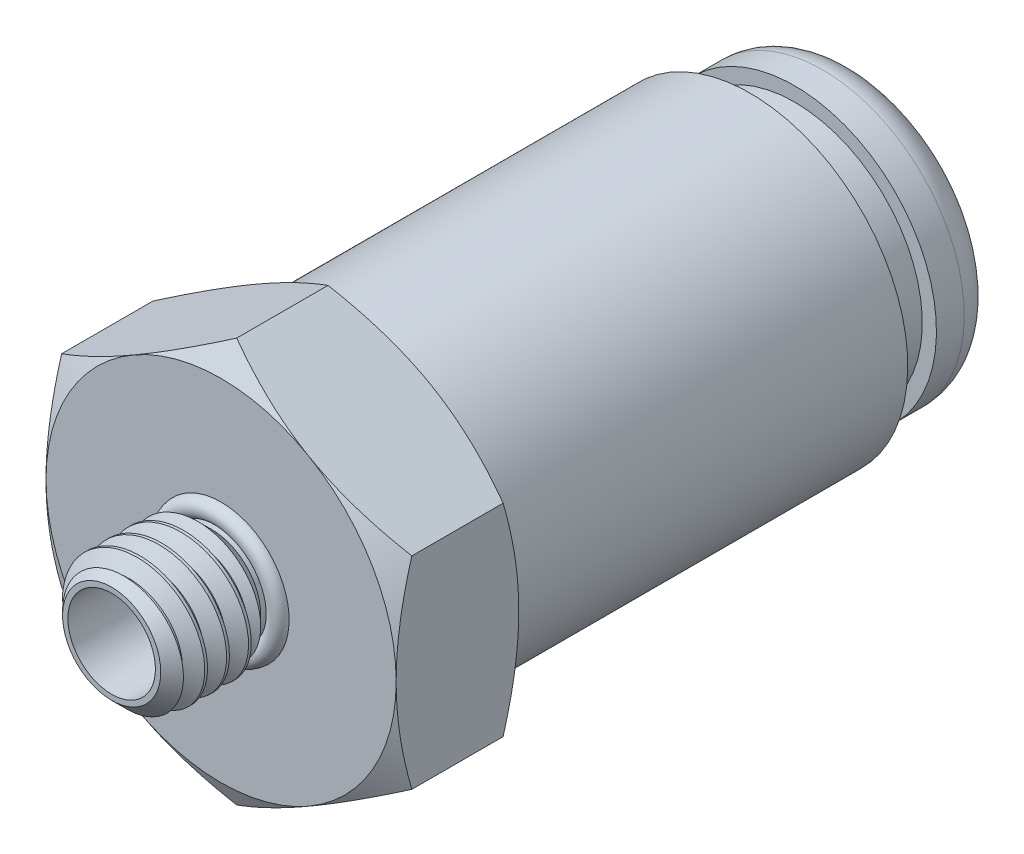
from build123d import *

# Parameters (mm, degrees)
SKETCH1_R          = 1.5
EXTRUDE1_DEPTH     = 2.5
CUT_SWEEP1_PITCH   = 0.5
EXTRUDE2_DEPTH     = 2.8
SKETCH6_OUTSIDE_W  = 44.148
SKETCH6_OUTSIDE_H  = 45.386
SKETCH6_OUTSIDE_R  = 4
CUT_EXTRUDE1_DEPTH = 9.088469224
CUT_EXTRUDE1_DRAFT = -60
SKETCH7_OUTSIDE_W  = 39.41
SKETCH7_OUTSIDE_H  = 40.648
SKETCH7_OUTSIDE_R  = 4
CUT_EXTRUDE2_DEPTH = 7.721111019
CUT_EXTRUDE2_DRAFT = -60
SKETCH9_R          = 1
CUT_EXTRUDE3_DEPTH = 14.199368672
CUT_EXTRUDE4_START = -1.8
SKETCH10_R         = 2
CUT_EXTRUDE4_DEPTH = 1.8
SKETCH12_W         = 0.433012702
SKETCH12_H         = 0.433012702
SKETCH13_R         = 0.216506351


with BuildPart() as part:
    # Sketch1 → Extrude1 (new body)
    with BuildSketch(Plane.XY):
        Circle(SKETCH1_R)
    extrude(amount=-EXTRUDE1_DEPTH)

    # Cut-Sweep1: the profile of Sketch3 screwed along a right-hand helix of 6 turns, 6 arcs to a turn; built about Z, then put on its axis
    cut_sweep1_z = Axis((0, 0, 0), (0, 0, 1))
    cut_sweep1_corners = [(1.175240474, 0, -0.25), (1.175240474, 0, -0.1875), (1.527063294, 0, 0.015625), (1.527063294, 0, -0.453125)]
    with BuildLine(mode=Mode.PRIVATE) as cut_sweep1_profile:
        Line(cut_sweep1_corners[0], cut_sweep1_corners[1])
        Line(cut_sweep1_corners[1], cut_sweep1_corners[2])
        Line(cut_sweep1_corners[2], cut_sweep1_corners[3])
        Line(cut_sweep1_corners[3], cut_sweep1_corners[0])
    cut_sweep1_cap = Face(cut_sweep1_profile.wire())
    cut_sweep1_turn_angles = [0, 30, 60, 90, 120, 150, 180, 210, 240, 270, 300, 330, 360]
    cut_sweep1_turn_weights = [1, 0.8660254037844387, 1, 0.8660254037844387, 1, 0.8660254037844387, 1, 0.8660254037844387, 1, 0.8660254037844387, 1, 0.8660254037844387, 1]
    cut_sweep1_turn_rails = [Edge.make_bspline([Vector(p[0], p[1], 0).rotate(cut_sweep1_z, cut_sweep1_turn_angles[k]) / cut_sweep1_turn_weights[k] + Vector(0, 0, p[2] + CUT_SWEEP1_PITCH * cut_sweep1_turn_angles[k] / 360) for k in range(13)], [0, 0, 0, 1, 1, 2, 2, 3, 3, 4, 4, 5, 5, 6, 6, 6], 2, cut_sweep1_turn_weights) for p in cut_sweep1_corners]
    cut_sweep1_turn_sides = [Face.make_surface_from_curves(cut_sweep1_turn_rails[p[0]], cut_sweep1_turn_rails[p[1]]) for p in [(0, 1), (1, 2), (2, 3), (3, 0)]]
    cut_sweep1 = Plane(origin=(0, 0, 0), x_dir=(0, 1, 0), z_dir=(0, 0, -1)) * Solid(Shell([*[p.moved(Location((0, 0, CUT_SWEEP1_PITCH * i))) for i in range(6) for p in cut_sweep1_turn_sides], cut_sweep1_cap, cut_sweep1_cap.rotate(cut_sweep1_z, 2160).moved(Location((0, 0, CUT_SWEEP1_PITCH * 2160 / 360)))]))
    add(cut_sweep1, mode=Mode.SUBTRACT)

    # Sketch4 → Cut-Revolve1 (revolve, cut)
    with BuildSketch(Plane(origin=(0, 0, 0), x_dir=(0, 0, -1), z_dir=(1, 0, 0)), mode=Mode.PRIVATE) as cut_revolve1_sk:
        Polygon((2.5, 1.121113886), (2.283493649, 1.121113886), (1.850480947, 1.554126588), (2.5, 1.554126588), align=None)
        Polygon((0.433012702, 1.554126588), (0, 1.121113886), (0, 1.554126588), align=None)
    revolve(cut_revolve1_sk.sketch.rotate(Axis((0, 0, 0), (0, 0, -1)), 90), axis=Axis((0, 0, 0), (0, 0, -1)), mode=Mode.SUBTRACT)

    # Sketch5 → Extrude2 (add)
    with BuildSketch(Plane(origin=(0, 0, -2.5), x_dir=(-1, 0, 0), z_dir=(0, 0, -1))):
        Polygon((0, 4.618802154), (-4, 2.309401077), (-4, -2.309401077), (0, -4.618802154), (4, -2.309401077), (4, 2.309401077), align=None)
    extrude(amount=EXTRUDE2_DEPTH)


with BuildPart() as cut_extrude1_tool:
    # Sketch6 outside → Cut-Extrude1 (with draft: the straight prism first)
    with BuildSketch(Plane(origin=(0, 0, -5.3), x_dir=(-1, 0, 0), z_dir=(0, 0, -1))):
        Rectangle(SKETCH6_OUTSIDE_W, SKETCH6_OUTSIDE_H)
        Circle(SKETCH6_OUTSIDE_R, mode=Mode.SUBTRACT)
    extrude(amount=-CUT_EXTRUDE1_DEPTH)
    # Cut-Extrude1: the draft: its side faces are tilted about the plane it starts from
    cut_extrude1_sides = [cut_extrude1_tool.faces().sort_by_distance(p)[0] for p in [
        (0, -22.693, -0.755765388),
        (-22.074, 0, -0.755765388),
        (0, 22.693, -0.755765388),
        (22.074, 0, -0.755765388),
        (4, 0, -0.755765388),
    ]]
    draft(cut_extrude1_sides, Plane(origin=(0, 0, -5.3), x_dir=(-1, 0, 0), z_dir=(0, 0, -1)), CUT_EXTRUDE1_DRAFT)


with BuildPart() as part_1:
    add(part.part)

    # Cut-Extrude1: cut by cut_extrude1_tool
    add(cut_extrude1_tool.part, mode=Mode.SUBTRACT)


with BuildPart() as cut_extrude2_tool:
    # Sketch7 outside → Cut-Extrude2 (with draft: the straight prism first)
    with BuildSketch(Plane.XY.offset(-2.5)):
        Rectangle(SKETCH7_OUTSIDE_W, SKETCH7_OUTSIDE_H)
        Circle(SKETCH7_OUTSIDE_R, mode=Mode.SUBTRACT)
    extrude(amount=-CUT_EXTRUDE2_DEPTH)
    # Cut-Extrude2: the draft: its side faces are tilted about the plane it starts from
    cut_extrude2_sides = [cut_extrude2_tool.faces().sort_by_distance(p)[0] for p in [
        (0, -20.324, -6.36055551),
        (19.705, 0, -6.36055551),
        (0, 20.324, -6.36055551),
        (-19.705, 0, -6.36055551),
        (-4, 0, -6.36055551),
    ]]
    draft(cut_extrude2_sides, Plane.XY.offset(-2.5), CUT_EXTRUDE2_DRAFT)


with BuildPart() as part_2:
    add(part_1.part)

    # Cut-Extrude2: cut by cut_extrude2_tool
    add(cut_extrude2_tool.part, mode=Mode.SUBTRACT)

    # Sketch8 → Revolve1 (revolve)
    with BuildSketch(Plane(origin=(0, 0, 0), x_dir=(0, 0, -1), z_dir=(1, 0, 0)), mode=Mode.PRIVATE) as revolve1_sk:
        with BuildLine():
            Line((15.603, 3.24), (16.238, 3.24))
            ThreePointArc((16.238, 3.24), (16.776815367, 3.016815367), (17, 2.478))
            Line((17, 2.478), (17, 2.381))
            Line((17, 2.381), (16.619, 2))
            Line((16.619, 2), (5.3, 2))
            Line((5.3, 2), (5.3, 3.6))
            Line((5.3, 3.6), (14.587, 3.6))
            Line((14.587, 3.6), (14.587, 2.916))
            Line((14.587, 2.916), (15.603, 2.916))
            Line((15.603, 2.916), (15.603, 3.24))
        make_face()
    revolve(revolve1_sk.sketch.rotate(Axis((0, 0, 0), (0, 0, -1)), 180), axis=Axis((0, 0, 0), (0, 0, -1)))

    # Sketch9 → Cut-Extrude3 (cut, through all)
    with BuildSketch(Plane(origin=(0, 0, -5.3), x_dir=(-1, 0, 0), z_dir=(0, 0, -1))):
        Circle(SKETCH9_R)
    extrude(amount=-CUT_EXTRUDE3_DEPTH, mode=Mode.SUBTRACT)

    # Sketch10 → Cut-Extrude4 (cut)
    with BuildSketch(Plane(origin=(0, 0, -5.3), x_dir=(-1, 0, 0), z_dir=(0, 0, -1)).offset(CUT_EXTRUDE4_START)):
        with Locations(Location((0, 0, 0), (0, 0, 270))):
            Circle(SKETCH10_R)
    extrude(amount=CUT_EXTRUDE4_DEPTH, mode=Mode.SUBTRACT)

    # Sketch12 → Cut-Revolve2 (revolve, cut)
    with BuildSketch(Plane(origin=(0, 0, 0), x_dir=(0, 0, -1), z_dir=(1, 0, 0)), mode=Mode.PRIVATE) as cut_revolve2_sk:
        with Locations((2.5, 1.337620237)):
            Rectangle(SKETCH12_W, SKETCH12_H)
    revolve(cut_revolve2_sk.sketch.rotate(Axis((0, 0, -17), (0, 0, 1)), 270), axis=Axis((0, 0, -17), (0, 0, 1)), mode=Mode.SUBTRACT)


with BuildPart() as body_2:
    # Sketch13 → Revolve2 (revolve)
    with BuildSketch(Plane(origin=(0, 0, 0), x_dir=(0, 0, -1), z_dir=(1, 0, 0)), mode=Mode.PRIVATE) as revolve2_sk:
        with Locations((2.5, 1.337620237)):
            Circle(SKETCH13_R)
    revolve(revolve2_sk.sketch.rotate(Axis((0, 0, -17), (0, 0, 1)), 270), axis=Axis((0, 0, -17), (0, 0, 1)))


solid = Compound([part_2.part, body_2.part])
